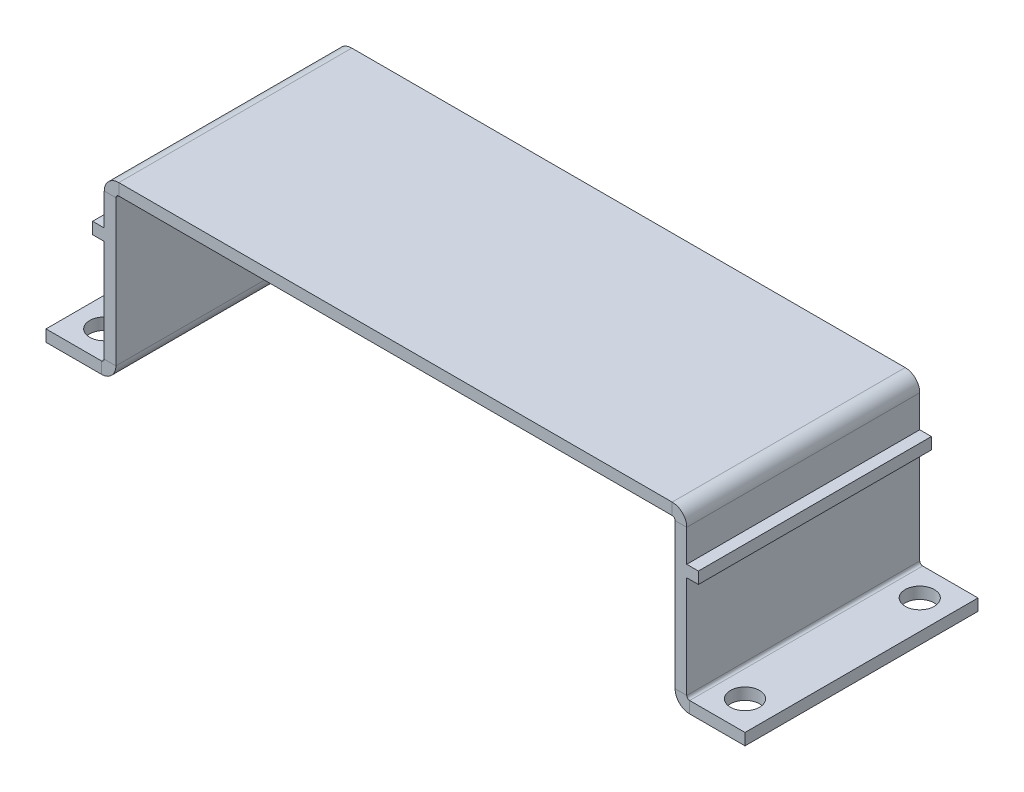
from build123d import *

# Parameters (mm, degrees)
BASE_FLANGE1_DEPTH  = 40
CUT_EXTRUDE1_REACH  = 132
SKETCH6_R           = 2.5
SKETCH7_W           = 2
SKETCH7_H           = 2
BOSS_EXTRUDE1_DEPTH = 40


# Sheet-metal steps are written as plain solids
with BuildPart() as part:
    # Sketch1 → Base-Flange1 (new body)
    with BuildSketch(Plane.XY):
        with BuildLine():
            Line((0, 0), (9.5, 0))
            ThreePointArc((9.5, 0), (9.853553391, 0.146446609), (10, 0.5))
            Line((10, 0.5), (10, 25.5))
            ThreePointArc((10, 25.5), (10.732233047, 27.267766953), (12.5, 28))
            Line((12.5, 28), (107.5, 28))
            ThreePointArc((107.5, 28), (109.267766953, 27.267766953), (110, 25.5))
            Line((110, 25.5), (110, 0.5))
            ThreePointArc((110, 0.5), (110.146446609, 0.146446609), (110.5, 0))
            Line((110.5, 0), (120, 0))
            Line((120, 0), (120, -2))
            Line((120, -2), (110.5, -2))
            ThreePointArc((110.5, -2), (108.732233047, -1.267766953), (108, 0.5))
            Line((108, 0.5), (108, 25.5))
            ThreePointArc((108, 25.5), (107.853553391, 25.853553391), (107.5, 26))
            Line((107.5, 26), (12.5, 26))
            ThreePointArc((12.5, 26), (12.146446609, 25.853553391), (12, 25.5))
            Line((12, 25.5), (12, 0.5))
            ThreePointArc((12, 0.5), (11.267766953, -1.267766953), (9.5, -2))
            Line((9.5, -2), (0, -2))
            Line((0, -2), (0, 0))
        make_face()
    extrude(amount=BASE_FLANGE1_DEPTH)

    # Sketch6 → Cut-Extrude1 (cut, up to next)
    with BuildSketch(Plane.XZ.offset(2), mode=Mode.PRIVATE) as cut_extrude1_sk1:
        with Locations(Location((5, 35, 0), (0, 0, 270))):
            Circle(SKETCH6_R)
    cut_extrude1_tool1 = extrude(cut_extrude1_sk1.sketch, amount=-CUT_EXTRUDE1_REACH, mode=Mode.PRIVATE) & part.part
    # Sketch6 → Cut-Extrude1 (cut, up to next)
    with BuildSketch(Plane.XZ.offset(2), mode=Mode.PRIVATE) as cut_extrude1_sk2:
        with Locations(Location((5, 5, 0), (0, 0, 270))):
            Circle(SKETCH6_R)
    cut_extrude1_tool2 = extrude(cut_extrude1_sk2.sketch, amount=-CUT_EXTRUDE1_REACH, mode=Mode.PRIVATE) & part.part
    # Sketch6 → Cut-Extrude1 (cut, up to next)
    with BuildSketch(Plane.XZ.offset(2), mode=Mode.PRIVATE) as cut_extrude1_sk3:
        with Locations(Location((115, 5, 0), (0, 0, 270))):
            Circle(SKETCH6_R)
    cut_extrude1_tool3 = extrude(cut_extrude1_sk3.sketch, amount=-CUT_EXTRUDE1_REACH, mode=Mode.PRIVATE) & part.part
    # Sketch6 → Cut-Extrude1 (cut, up to next)
    with BuildSketch(Plane.XZ.offset(2), mode=Mode.PRIVATE) as cut_extrude1_sk4:
        with Locations(Location((115, 35, 0), (0, 0, 270))):
            Circle(SKETCH6_R)
    cut_extrude1_tool4 = extrude(cut_extrude1_sk4.sketch, amount=-CUT_EXTRUDE1_REACH, mode=Mode.PRIVATE) & part.part
    add(cut_extrude1_tool1.solids().sort_by_distance((5, -2, 35))[0], mode=Mode.SUBTRACT)
    add(cut_extrude1_tool2.solids().sort_by_distance((5, -2, 5))[0], mode=Mode.SUBTRACT)
    add(cut_extrude1_tool3.solids().sort_by_distance((115, -2, 5))[0], mode=Mode.SUBTRACT)
    add(cut_extrude1_tool4.solids().sort_by_distance((115, -2, 35))[0], mode=Mode.SUBTRACT)

    # Sketch7 → Boss-Extrude1 (add)
    with BuildSketch(Plane.XY.offset(40)):
        with Locations((9, 19)):
            Rectangle(SKETCH7_W, SKETCH7_H)
        with Locations((111, 19)):
            Rectangle(SKETCH7_W, SKETCH7_H)
    extrude(amount=-BOSS_EXTRUDE1_DEPTH)


solid = part.part
